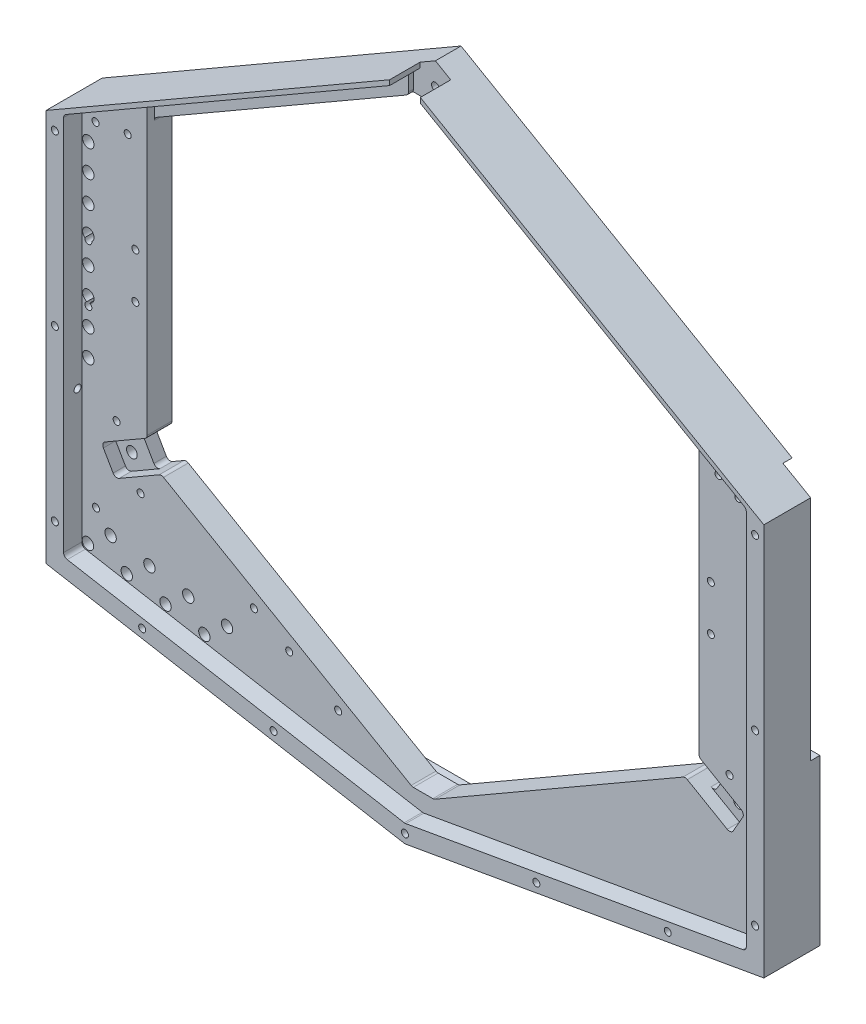
from build123d import *

# Parameters (mm, degrees)
OUTLINE_DEPTH                           = 12.8
INSIDE_CUTOUT_DEPTH                     = 4.14
CUT_FOR_SPRING_BASE_DEPTH               = 114.47095047549391
J_FLEX_MOUNTING_POINT_DEPTH             = 5.85
SPRING_BASE_MOUNTING_CUT_DEPTH          = 3
CENTRAL_COPPER_FLEX_CUTOUT_DEPTH        = 6.95
M2_TAP_DRILL_FOR_BACKPLATE_D            = 1.6
M2_TAP_DRILL_FOR_BACKPLATE_DEPTH        = 3.5
M2_TAP_DRILL_FOR_BACKPLATE_TIP          = 0.48068849522204826
OUTER_COPPER_FLEX_CUTOUTS_DEPTH         = 3
F_2_CLEARANCE_HOLES_FOR_FLEX_FEET_D     = 2.4384
CHANNELS_FOR_OUTER_FLEX_DEPTH           = 2.81
SKETCH17_R                              = 0.7999999999999954
OPTIONAL_ALIGNMENT_PINS_DEPTH           = 3
SMA_LINES_REACH                         = 115.471
SKETCH19_R                              = 1.2999999999999945
SKETCH19_R_2                            = 1.2999999999999956
SKETCH19_R_3                            = 1.2999999999999936
SKETCH19_R_4                            = 1.300000000000009
SKETCH19_R_5                            = 1.2999999999999803
SMA_CUTAWAY_DEPTH                       = 2.11
FILLET4_R                               = 3
M2X0_4_TAPPED_FOR_SMAS_D                = 1.6
M2X0_4_TAPPED_FOR_SMAS_DEPTH            = 5
M2X0_4_TAPPED_FOR_SMAS_TIP              = 0.48068849522204826
SLIGHT_RELIEF_UNDER_ARRAY_DEPTH         = 1.66
M2X0_4_TAPPED_FOR_RADIATION_COVER_D     = 1.6
M2X0_4_TAPPED_FOR_RADIATION_COVER_DEPTH = 5
M2X0_4_TAPPED_FOR_RADIATION_COVER_TIP   = 0.48068849522204826
M2X0_4_TAP_FOR_PCB_MOUNTS_D             = 1.6
M2X0_4_TAP_FOR_PCB_MOUNTS_DEPTH         = 4.7
M2X0_4_TAP_FOR_PCB_MOUNTS_TIP           = 0.48068849522204826
TAP_DRILL_FOR_M3X0_5_TAP1_D             = 2.5
TAP_DRILL_FOR_M3X0_5_TAP1_DEPTH         = 6
TAP_DRILL_FOR_M3X0_5_TAP1_TIP           = 0.7510757737844503
CUT_EXTRUDE1_DEPTH                      = 30
M2X0_4_TAP_FOR_THERMOMETER_D            = 1.6
M2X0_4_TAP_FOR_THERMOMETER_DEPTH        = 5
M2X0_4_TAP_FOR_THERMOMETER_TIP          = 0.48068849522204826
FILLET1_R                               = 1
FILLET5_R                               = 1
FILLET6_R                               = 3
TAP_DRILL_FOR_2_56_TAP2_D               = 1.778


with BuildPart() as part:
    # Sketch2 → Outline (new body)
    with BuildSketch(Plane.XY):
        Polygon((-81.94000000000018, 26.61740330842736), (-5.69e-15, 73.92548436582511), (81.93999999999981, 26.617403308426777), (81.93999999999981, -62.99628283492352), (-2.3854e-13, -77.44451563417489), (-81.94000000000018, -62.99628283492292), align=None)
    extrude(amount=-OUTLINE_DEPTH)

    # Sketch3 → Inside Cutout (cut)
    with BuildSketch(Plane.XY):
        Polygon((-77.94000000000018, 27.772103846806722), (-4.5471e-13, 72.77078382744601), (77.93999999999984, 27.77210384680643), (77.93999999999983, -59.63988431021399), (-2.2204e-13, -73.38280918663152), (-77.94000000000018, -59.63988431021344), align=None)
    extrude(amount=-INSIDE_CUTOUT_DEPTH, mode=Mode.SUBTRACT)

    # Sketch5 → Cut for Spring Base (cut, through all)
    with BuildSketch(Plane(origin=(0, 0, -12.8), x_dir=(-1, 0, 0), z_dir=(0, 0, -1))):
        Polygon((9.54e-15, -70.89415224396323), (-63.000000000000306, -34.52108528501766), (-63.000000000000306, 31.778914714982335), (-4.999999999999997, 65.26523032798063), (-5, 69.88403248149764), (4.5471e-13, 72.77078382744601), (5.000000000000001, 69.88403248149814), (5.000000000000001, 65.26523032798113), (62.999999999999694, 31.778914714983017), (62.999999999999694, -34.52108528501698), align=None)
    extrude(amount=-CUT_FOR_SPRING_BASE_DEPTH, mode=Mode.SUBTRACT)

    # Sketch7 → J Flex Mounting Point (add)
    with BuildSketch(Plane(origin=(0, 0, -12.8), x_dir=(-1, 0, 0), z_dir=(0, 0, -1))):
        Polygon((-4.999999999999885, 69.88403248149771), (4.545e-13, 72.77078382744601), (5.000000000000114, 69.88403248149808), (5.000000000000114, 60.77078382744578), (-4.999999999999885, 60.77078382744578), align=None)
    extrude(amount=-J_FLEX_MOUNTING_POINT_DEPTH)

    # Sketch6 → Spring Base Mounting Cut (cut)
    with BuildSketch(Plane(origin=(0, 0, -12.8), x_dir=(-1, 0, 0), z_dir=(0, 0, -1))):
        Polygon((-67.5000000000003, 33.79964065714584), (-67.5000000000003, -37.6965117655606), (-10.000000000001764, -70.89415224396323), (9.54e-15, -70.89415224396323), (9.999999999999995, -70.89415224396323), (67.4999999999997, -37.69651176555993), (67.4999999999997, 33.79964065714669), (6.94e-15, 72.77078382744575), align=None)
    extrude(amount=-SPRING_BASE_MOUNTING_CUT_DEPTH, mode=Mode.SUBTRACT)

    # Sketch9 → Central Copper Flex cutout (cut)
    with BuildSketch(Plane.XY):
        Polygon((3.4999999999995532, 71.90475842366207), (3.4999999999995532, 70.75005788528236), (-4.5471e-13, 72.77078382744601), (-3.5000000000004468, 70.75005788528233), (-3.5000000000004468, 71.90475842366156), (-9.54e-15, 73.92548436582551), align=None)
    extrude(amount=-CENTRAL_COPPER_FLEX_CUTOUT_DEPTH, mode=Mode.SUBTRACT)

    # M2 Tap Drill for Backplate
    with Locations(Plane(origin=(0, 0, -9.799999999999999), x_dir=(-1, 0, 0), z_dir=(0, 0, -1))):
        with Locations((-65, 24.304214177), (-41.13620668, 46.134032481), (-19.485571585, 58.634032481), (19.485571585, 58.634032481), (41.13620668, 46.134032481), (65, 24.324214177), (65, 1.824214177), (65, -20.675785823), (52.009618943, -43.175785823), (32.95706006, -54.175785823), (15.636551984, -64.175785823), (-15.636551984, -64.175785823), (-32.95706006, -54.175785823), (-52.009618943, -43.175785823), (-65, -20.695785823), (-65, 1.804214177)):
            Hole(M2_TAP_DRILL_FOR_BACKPLATE_D / 2, depth=M2_TAP_DRILL_FOR_BACKPLATE_DEPTH)
            with Locations((0, 0, -(M2_TAP_DRILL_FOR_BACKPLATE_DEPTH + M2_TAP_DRILL_FOR_BACKPLATE_TIP / 2))):  # 118° drill point
                Cone(0, M2_TAP_DRILL_FOR_BACKPLATE_D / 2, M2_TAP_DRILL_FOR_BACKPLATE_TIP, mode=Mode.SUBTRACT)

    # Sketch12 → Outer Copper Flex cutouts (cut)
    with BuildSketch(Plane(origin=(0, 0, -12.8), x_dir=(-1, 0, 0), z_dir=(0, 0, -1))):
        Polygon((63.999999999999694, -39.71723770772362), (67.4999999999997, -37.69651176555993), (67.4999999999997, -33.655059881232546), (74.44615242270633, -37.66542285231435), (70.94615242270635, -43.72760067880543), align=None)
        Polygon((-67.5000000000003, -33.65505988123323), (-67.5000000000003, -37.6965117655606), (-64.0000000000003, -39.717237707724294), (-70.94615242270693, -43.72760067880614), (-74.44615242270693, -37.66542285231507), align=None)
    extrude(amount=-OUTER_COPPER_FLEX_CUTOUTS_DEPTH, mode=Mode.SUBTRACT)

    # #2 Clearance Holes for Flex Feet (through all)
    with Locations(Plane(origin=(0, 0, -9.799999999999999), x_dir=(-1, 0, 0), z_dir=(0, 0, -1))):
        with Locations((69.303682938, -38.129015634), (-69.308013065, -38.131515634)):
            Hole(F_2_CLEARANCE_HOLES_FOR_FLEX_FEET_D / 2)

    # Sketch15 → Channels for Outer Flex (cut)
    with BuildSketch(Plane.XY.offset(-4.14)):
        Polygon((-62.999999999999694, -30.794540870306964), (-73.50175914920308, -36.85773434206413), (-70.27447701773319, -42.44755096412918), (-59.77271786852982, -36.38435749237198), (-62.999999999999694, -34.52108528501698), align=None)
        Polygon((63.000000000000306, -34.52108528501766), (63.000000000000306, -30.857546254101788), (73.47880714475102, -36.9074883799115), (70.30608927622175, -42.4027969262845), (59.82728213147089, -36.35285480047483), align=None)
    extrude(amount=-CHANNELS_FOR_OUTER_FLEX_DEPTH, mode=Mode.SUBTRACT)

    # Sketch17 → Optional Alignment Pins (cut)
    with BuildSketch(Plane(origin=(0, 0, -9.799999999999999), x_dir=(-1, 0, 0), z_dir=(0, 0, -1))):
        with Locations((-65.00000000000033, -9.44578582339588)):
            Circle(SKETCH17_R)
        with Locations((64.99999999999972, -9.425785823396222)):
            Circle(SKETCH17_R)
    extrude(amount=-OPTIONAL_ALIGNMENT_PINS_DEPTH, mode=Mode.SUBTRACT)

    # Sketch19 → SMA_Lines (cut, up to next)
    with BuildSketch(Plane(origin=(0, 0, -12.8), x_dir=(-1, 0, 0), z_dir=(0, 0, -1)), mode=Mode.PRIVATE) as sma_lines_sk1:
        with Locations((76.44000000000017, 21.11740330842736)):
            Circle(SKETCH19_R)
    sma_lines_tool1 = extrude(sma_lines_sk1.sketch, amount=-SMA_LINES_REACH, mode=Mode.PRIVATE) & part.part
    # Sketch19 → SMA_Lines (cut, up to next)
    with BuildSketch(Plane(origin=(0, 0, -12.8), x_dir=(-1, 0, 0), z_dir=(0, 0, -1)), mode=Mode.PRIVATE) as sma_lines_sk2:
        with Locations((-76.43999999999981, 22.617403308426777)):
            Circle(SKETCH19_R)
    sma_lines_tool2 = extrude(sma_lines_sk2.sketch, amount=-SMA_LINES_REACH, mode=Mode.PRIVATE) & part.part
    # Sketch19 → SMA_Lines (cut, up to next)
    with BuildSketch(Plane(origin=(0, 0, -12.8), x_dir=(-1, 0, 0), z_dir=(0, 0, -1)), mode=Mode.PRIVATE) as sma_lines_sk3:
        with Locations((-76.4399999999995, 16.517403308426776)):
            Circle(SKETCH19_R_2)
    sma_lines_tool3 = extrude(sma_lines_sk3.sketch, amount=-SMA_LINES_REACH, mode=Mode.PRIVATE) & part.part
    # Sketch19 → SMA_Lines (cut, up to next)
    with BuildSketch(Plane(origin=(0, 0, -12.8), x_dir=(-1, 0, 0), z_dir=(0, 0, -1)), mode=Mode.PRIVATE) as sma_lines_sk4:
        with Locations((-76.43999999999916, 10.41740330842678)):
            Circle(SKETCH19_R)
    sma_lines_tool4 = extrude(sma_lines_sk4.sketch, amount=-SMA_LINES_REACH, mode=Mode.PRIVATE) & part.part
    # Sketch19 → SMA_Lines (cut, up to next)
    with BuildSketch(Plane(origin=(0, 0, -12.8), x_dir=(-1, 0, 0), z_dir=(0, 0, -1)), mode=Mode.PRIVATE) as sma_lines_sk5:
        with Locations((-76.43999999999885, 4.3174033084267815)):
            Circle(SKETCH19_R)
    sma_lines_tool5 = extrude(sma_lines_sk5.sketch, amount=-SMA_LINES_REACH, mode=Mode.PRIVATE) & part.part
    # Sketch19 → SMA_Lines (cut, up to next)
    with BuildSketch(Plane(origin=(0, 0, -12.8), x_dir=(-1, 0, 0), z_dir=(0, 0, -1)), mode=Mode.PRIVATE) as sma_lines_sk6:
        with Locations((-76.43999999999852, -1.7825966915732196)):
            Circle(SKETCH19_R)
    sma_lines_tool6 = extrude(sma_lines_sk6.sketch, amount=-SMA_LINES_REACH, mode=Mode.PRIVATE) & part.part
    # Sketch19 → SMA_Lines (cut, up to next)
    with BuildSketch(Plane(origin=(0, 0, -12.8), x_dir=(-1, 0, 0), z_dir=(0, 0, -1)), mode=Mode.PRIVATE) as sma_lines_sk7:
        with Locations((-76.4399999999982, -7.882596691573221)):
            Circle(SKETCH19_R)
    sma_lines_tool7 = extrude(sma_lines_sk7.sketch, amount=-SMA_LINES_REACH, mode=Mode.PRIVATE) & part.part
    # Sketch19 → SMA_Lines (cut, up to next)
    with BuildSketch(Plane(origin=(0, 0, -12.8), x_dir=(-1, 0, 0), z_dir=(0, 0, -1)), mode=Mode.PRIVATE) as sma_lines_sk8:
        with Locations((-76.43999999999787, -13.982596691573216)):
            Circle(SKETCH19_R)
    sma_lines_tool8 = extrude(sma_lines_sk8.sketch, amount=-SMA_LINES_REACH, mode=Mode.PRIVATE) & part.part
    # Sketch19 → SMA_Lines (cut, up to next)
    with BuildSketch(Plane(origin=(0, 0, -12.8), x_dir=(-1, 0, 0), z_dir=(0, 0, -1)), mode=Mode.PRIVATE) as sma_lines_sk9:
        with Locations((-76.43999999999755, -20.082596691573215)):
            Circle(SKETCH19_R)
    sma_lines_tool9 = extrude(sma_lines_sk9.sketch, amount=-SMA_LINES_REACH, mode=Mode.PRIVATE) & part.part
    # Sketch19 → SMA_Lines (cut, up to next)
    with BuildSketch(Plane(origin=(0, 0, -12.8), x_dir=(-1, 0, 0), z_dir=(0, 0, -1)), mode=Mode.PRIVATE) as sma_lines_sk10:
        with Locations((76.44000000000041, 15.01740330842736)):
            Circle(SKETCH19_R)
    sma_lines_tool10 = extrude(sma_lines_sk10.sketch, amount=-SMA_LINES_REACH, mode=Mode.PRIVATE) & part.part
    # Sketch19 → SMA_Lines (cut, up to next)
    with BuildSketch(Plane(origin=(0, 0, -12.8), x_dir=(-1, 0, 0), z_dir=(0, 0, -1)), mode=Mode.PRIVATE) as sma_lines_sk11:
        with Locations((76.44000000000065, 8.91740330842736)):
            Circle(SKETCH19_R)
    sma_lines_tool11 = extrude(sma_lines_sk11.sketch, amount=-SMA_LINES_REACH, mode=Mode.PRIVATE) & part.part
    # Sketch19 → SMA_Lines (cut, up to next)
    with BuildSketch(Plane(origin=(0, 0, -12.8), x_dir=(-1, 0, 0), z_dir=(0, 0, -1)), mode=Mode.PRIVATE) as sma_lines_sk12:
        with Locations((76.44000000000088, 2.8174033084273633)):
            Circle(SKETCH19_R)
    sma_lines_tool12 = extrude(sma_lines_sk12.sketch, amount=-SMA_LINES_REACH, mode=Mode.PRIVATE) & part.part
    # Sketch19 → SMA_Lines (cut, up to next)
    with BuildSketch(Plane(origin=(0, 0, -12.8), x_dir=(-1, 0, 0), z_dir=(0, 0, -1)), mode=Mode.PRIVATE) as sma_lines_sk13:
        with Locations((76.44000000000112, -3.282596691572638)):
            Circle(SKETCH19_R)
    sma_lines_tool13 = extrude(sma_lines_sk13.sketch, amount=-SMA_LINES_REACH, mode=Mode.PRIVATE) & part.part
    # Sketch19 → SMA_Lines (cut, up to next)
    with BuildSketch(Plane(origin=(0, 0, -12.8), x_dir=(-1, 0, 0), z_dir=(0, 0, -1)), mode=Mode.PRIVATE) as sma_lines_sk14:
        with Locations((76.44000000000135, -9.382596691572639)):
            Circle(SKETCH19_R)
    sma_lines_tool14 = extrude(sma_lines_sk14.sketch, amount=-SMA_LINES_REACH, mode=Mode.PRIVATE) & part.part
    # Sketch19 → SMA_Lines (cut, up to next)
    with BuildSketch(Plane(origin=(0, 0, -12.8), x_dir=(-1, 0, 0), z_dir=(0, 0, -1)), mode=Mode.PRIVATE) as sma_lines_sk15:
        with Locations((76.44000000000159, -15.482596691572633)):
            Circle(SKETCH19_R)
    sma_lines_tool15 = extrude(sma_lines_sk15.sketch, amount=-SMA_LINES_REACH, mode=Mode.PRIVATE) & part.part
    # Sketch19 → SMA_Lines (cut, up to next)
    with BuildSketch(Plane(origin=(0, 0, -12.8), x_dir=(-1, 0, 0), z_dir=(0, 0, -1)), mode=Mode.PRIVATE) as sma_lines_sk16:
        with Locations((76.44000000000183, -21.582596691572636)):
            Circle(SKETCH19_R)
    sma_lines_tool16 = extrude(sma_lines_sk16.sketch, amount=-SMA_LINES_REACH, mode=Mode.PRIVATE) & part.part
    # Sketch19 → SMA_Lines (cut, up to next)
    with BuildSketch(Plane(origin=(0, 0, -12.8), x_dir=(-1, 0, 0), z_dir=(0, 0, -1)), mode=Mode.PRIVATE) as sma_lines_sk17:
        with Locations((49.940000000000175, -63.053899852222344)):
            Circle(SKETCH19_R_3)
    sma_lines_tool17 = extrude(sma_lines_sk17.sketch, amount=-SMA_LINES_REACH, mode=Mode.PRIVATE) & part.part
    # Sketch19 → SMA_Lines (cut, up to next)
    with BuildSketch(Plane(origin=(0, 0, -12.8), x_dir=(-1, 0, 0), z_dir=(0, 0, -1)), mode=Mode.PRIVATE) as sma_lines_sk18:
        with Locations((44.76298760688293, -58.8896137571623)):
            Circle(SKETCH19_R_3)
    sma_lines_tool18 = extrude(sma_lines_sk18.sketch, amount=-SMA_LINES_REACH, mode=Mode.PRIVATE) & part.part
    # Sketch19 → SMA_Lines (cut, up to next)
    with BuildSketch(Plane(origin=(0, 0, -12.8), x_dir=(-1, 0, 0), z_dir=(0, 0, -1)), mode=Mode.PRIVATE) as sma_lines_sk19:
        with Locations((53.626257383992794, -57.32678015815989)):
            Circle(SKETCH19_R_3)
    sma_lines_tool19 = extrude(sma_lines_sk19.sketch, amount=-SMA_LINES_REACH, mode=Mode.PRIVATE) & part.part
    # Sketch19 → SMA_Lines (cut, up to next)
    with BuildSketch(Plane(origin=(0, 0, -12.8), x_dir=(-1, 0, 0), z_dir=(0, 0, -1)), mode=Mode.PRIVATE) as sma_lines_sk20:
        with Locations((58.80326977711004, -61.491066253219934)):
            Circle(SKETCH19_R_3)
    sma_lines_tool20 = extrude(sma_lines_sk20.sketch, amount=-SMA_LINES_REACH, mode=Mode.PRIVATE) & part.part
    # Sketch19 → SMA_Lines (cut, up to next)
    with BuildSketch(Plane(origin=(0, 0, -12.8), x_dir=(-1, 0, 0), z_dir=(0, 0, -1)), mode=Mode.PRIVATE) as sma_lines_sk21:
        with Locations((62.489527161102664, -55.76394655915748)):
            Circle(SKETCH19_R_4)
    sma_lines_tool21 = extrude(sma_lines_sk21.sketch, amount=-SMA_LINES_REACH, mode=Mode.PRIVATE) & part.part
    # Sketch19 → SMA_Lines (cut, up to next)
    with BuildSketch(Plane(origin=(0, 0, -12.8), x_dir=(-1, 0, 0), z_dir=(0, 0, -1)), mode=Mode.PRIVATE) as sma_lines_sk22:
        with Locations((67.66653955421991, -59.928232654217524)):
            Circle(SKETCH19_R_5)
    sma_lines_tool22 = extrude(sma_lines_sk22.sketch, amount=-SMA_LINES_REACH, mode=Mode.PRIVATE) & part.part
    # Sketch19 → SMA_Lines (cut, up to next)
    with BuildSketch(Plane(origin=(0, 0, -12.8), x_dir=(-1, 0, 0), z_dir=(0, 0, -1)), mode=Mode.PRIVATE) as sma_lines_sk23:
        with Locations((71.35279693821253, -54.20111296015507)):
            Circle(SKETCH19_R_3)
    sma_lines_tool23 = extrude(sma_lines_sk23.sketch, amount=-SMA_LINES_REACH, mode=Mode.PRIVATE) & part.part
    # Sketch19 → SMA_Lines (cut, up to next)
    with BuildSketch(Plane(origin=(0, 0, -12.8), x_dir=(-1, 0, 0), z_dir=(0, 0, -1)), mode=Mode.PRIVATE) as sma_lines_sk24:
        with Locations((76.52980933132977, -58.365399055215114)):
            Circle(SKETCH19_R_3)
    sma_lines_tool24 = extrude(sma_lines_sk24.sketch, amount=-SMA_LINES_REACH, mode=Mode.PRIVATE) & part.part
    add(sma_lines_tool1.solids().sort_by_distance((-76.44, 21.117403, -12.8))[0], mode=Mode.SUBTRACT)
    add(sma_lines_tool2.solids().sort_by_distance((76.44, 22.617403, -12.8))[0], mode=Mode.SUBTRACT)
    add(sma_lines_tool3.solids().sort_by_distance((76.44, 16.517403, -12.8))[0], mode=Mode.SUBTRACT)
    add(sma_lines_tool4.solids().sort_by_distance((76.44, 10.417403, -12.8))[0], mode=Mode.SUBTRACT)
    add(sma_lines_tool5.solids().sort_by_distance((76.44, 4.317403, -12.8))[0], mode=Mode.SUBTRACT)
    add(sma_lines_tool6.solids().sort_by_distance((76.44, -1.782597, -12.8))[0], mode=Mode.SUBTRACT)
    add(sma_lines_tool7.solids().sort_by_distance((76.44, -7.882597, -12.8))[0], mode=Mode.SUBTRACT)
    add(sma_lines_tool8.solids().sort_by_distance((76.44, -13.982597, -12.8))[0], mode=Mode.SUBTRACT)
    add(sma_lines_tool9.solids().sort_by_distance((76.44, -20.082597, -12.8))[0], mode=Mode.SUBTRACT)
    add(sma_lines_tool10.solids().sort_by_distance((-76.44, 15.017403, -12.8))[0], mode=Mode.SUBTRACT)
    add(sma_lines_tool11.solids().sort_by_distance((-76.44, 8.917403, -12.8))[0], mode=Mode.SUBTRACT)
    add(sma_lines_tool12.solids().sort_by_distance((-76.44, 2.817403, -12.8))[0], mode=Mode.SUBTRACT)
    add(sma_lines_tool13.solids().sort_by_distance((-76.44, -3.282597, -12.8))[0], mode=Mode.SUBTRACT)
    add(sma_lines_tool14.solids().sort_by_distance((-76.44, -9.382597, -12.8))[0], mode=Mode.SUBTRACT)
    add(sma_lines_tool15.solids().sort_by_distance((-76.44, -15.482597, -12.8))[0], mode=Mode.SUBTRACT)
    add(sma_lines_tool16.solids().sort_by_distance((-76.44, -21.582597, -12.8))[0], mode=Mode.SUBTRACT)
    add(sma_lines_tool17.solids().sort_by_distance((-49.94, -63.0539, -12.8))[0], mode=Mode.SUBTRACT)
    add(sma_lines_tool18.solids().sort_by_distance((-44.762988, -58.889614, -12.8))[0], mode=Mode.SUBTRACT)
    add(sma_lines_tool19.solids().sort_by_distance((-53.626257, -57.32678, -12.8))[0], mode=Mode.SUBTRACT)
    add(sma_lines_tool20.solids().sort_by_distance((-58.80327, -61.491066, -12.8))[0], mode=Mode.SUBTRACT)
    add(sma_lines_tool21.solids().sort_by_distance((-62.489527, -55.763947, -12.8))[0], mode=Mode.SUBTRACT)
    add(sma_lines_tool22.solids().sort_by_distance((-67.66654, -59.928233, -12.8))[0], mode=Mode.SUBTRACT)
    add(sma_lines_tool23.solids().sort_by_distance((-71.352797, -54.201113, -12.8))[0], mode=Mode.SUBTRACT)
    add(sma_lines_tool24.solids().sort_by_distance((-76.529809, -58.365399, -12.8))[0], mode=Mode.SUBTRACT)

    # Sketch20 → SMA Cutaway (cut)
    with BuildSketch(Plane(origin=(0, 0, -12.8), x_dir=(-1, 0, 0), z_dir=(0, 0, -1))):
        Polygon((67.4999999999997, 23.84466519800491), (73.08124278936407, 29.425907987369293), (81.94000000000017, 20.567150776733197), (81.94000000000018, -62.99628283492253), (42.44000000000018, -69.96119857290746), (42.44000000000018, -58.914909511451675), (37.67686027918577, -58.914909511451675), (37.67686027918577, -54.914909511451675), (42.4400000000002, -52.16490951145166), (63.999999999999694, -39.71723770772362), (67.4999999999997, -33.655059881232546), align=None)
        Polygon((-75.60958527266814, 30.27226995533369), (-67.5000000000003, 22.162684682665844), (-67.5000000000003, -25.38259669157322), (-81.93999999999981, -25.382596691573223), (-81.93999999999981, 26.61740330842717), align=None)
    extrude(amount=-SMA_CUTAWAY_DEPTH, mode=Mode.SUBTRACT)

    # Fillet4
    fillet4_edges = [part.edges().sort_by_distance(p)[0] for p in [
        (-37.67686027918577, -58.914909511451675, -11.745000000000001),
        (-73.08124278936407, 29.425907987369293, -11.745000000000001),
    ]]
    fillet(fillet4_edges, radius=FILLET4_R)

    # M2x0.4 Tapped for SMAs
    with Locations(Plane(origin=(0, 0, -10.689999999999998), x_dir=(-1, 0, 0), z_dir=(0, 0, -1))):
        with Locations((73.895, 23.662403308), (78.985, 18.572403308), (-78.985, 25.162403308), (-73.895, 20.072403308), (-78.985, 19.062403308), (-73.895, 13.972403308), (-78.985, 12.962403308), (-73.895, 7.872403308), (-78.985, 6.862403308), (-73.895, 1.772403308), (-78.985, 0.762403308), (-73.895, -4.327596692), (-78.985, -5.337596692), (-73.895, -10.427596692), (-78.985, -11.437596692), (-73.895, -16.527596692), (-78.985, -17.537596692), (-73.895, -22.627596692), (73.895, 17.562403308), (78.985, 12.472403308), (73.895, 11.462403308), (78.985, 6.372403308), (73.895, 5.362403308), (78.985, 0.272403308), (73.895, -0.737596692), (78.985, -5.827596692), (73.895, -6.837596692), (78.985, -11.927596692), (73.895, -12.937596692), (78.985, -18.027596692), (73.895, -19.037596692), (78.985, -24.127596692), (49.315, -59.508899852), (50.565, -66.598899852), (58.178269777, -57.946066253), (59.428269777, -65.036066253), (67.041539554, -56.383232654), (68.291539554, -63.473232654), (75.904809331, -54.820399055), (77.154809331, -61.910399055), (45.387987607, -62.434613757), (44.137987607, -55.344613757), (54.251257384, -60.871780158), (53.001257384, -53.781780158), (63.114527161, -59.308946559), (61.864527161, -52.218946559), (71.977796938, -57.74611296), (70.727796938, -50.65611296)):
            Hole(M2X0_4_TAPPED_FOR_SMAS_D / 2, depth=M2X0_4_TAPPED_FOR_SMAS_DEPTH)
            with Locations((0, 0, -(M2X0_4_TAPPED_FOR_SMAS_DEPTH + M2X0_4_TAPPED_FOR_SMAS_TIP / 2))):  # 118° drill point
                Cone(0, M2X0_4_TAPPED_FOR_SMAS_D / 2, M2X0_4_TAPPED_FOR_SMAS_TIP, mode=Mode.SUBTRACT)

    # Sketch23 → Slight Relief Under Array (cut)
    with BuildSketch(Plane.XY.offset(-4.14)):
        Polygon((-62.999999999999694, 31.778914714983017), (-62.999999999999694, 36.39771686850003), (-5.000000000000001, 69.88403248149814), (-5.000000000000001, 65.26523032798113), align=None)
        Polygon((4.999999999999999, 65.26523032798063), (4.999999999999999, 69.88403248149764), (63.000000000000306, 36.397716868499174), (63.000000000000306, 31.778914714982335), align=None)
    extrude(amount=-SLIGHT_RELIEF_UNDER_ARRAY_DEPTH, mode=Mode.SUBTRACT)

    # M2x0.4 Tapped for Radiation Cover
    with Locations(Plane.XY):
        with Locations((-79.94, 23.617403308), (-79.94, -53.63988431), (-30, -70.123852989), (30, -70.123852989), (79.94, -53.63988431), (79.94, 23.617403308), (-79.94, -15.011240501), (0, -75.41366241), (79.94, -15.011240501), (-60, -64.834043568), (60, -64.834043568)):
            Hole(M2X0_4_TAPPED_FOR_RADIATION_COVER_D / 2, depth=M2X0_4_TAPPED_FOR_RADIATION_COVER_DEPTH)
            with Locations((0, 0, -(M2X0_4_TAPPED_FOR_RADIATION_COVER_DEPTH + M2X0_4_TAPPED_FOR_RADIATION_COVER_TIP / 2))):  # 118° drill point
                Cone(0, M2X0_4_TAPPED_FOR_RADIATION_COVER_D / 2, M2X0_4_TAPPED_FOR_RADIATION_COVER_TIP, mode=Mode.SUBTRACT)

    # M2x0.4 Tap for PCB Mounts
    with Locations(Plane.XY.offset(-4.14)):
        with Locations((76.44, 12.367403308), (74.69, -12.632596692), (-76.44, 14.617403308), (-76.44, -11.382596692), (-74.69, -50.382596692), (-19.3942, -62.851596692), (-76.44, 1.617403308), (-67.45, 27.111803308), (-65.6984, 5.145603308), (-65.6984, -5.187396692), (-69.9656, -30.882596692), (-64.5046, -42.434796692), (-38.622, -52.234396692), (-30.5702, -56.755596692), (71.966178048, 24.850096108), (74.69, -0.132596692), (69.97, -30.882596692), (67.45, 27.111803308), (65.7, 5.145603308), (65.7, -5.187396692), (-74.788247876, 25.83669509)):
            Hole(M2X0_4_TAP_FOR_PCB_MOUNTS_D / 2, depth=M2X0_4_TAP_FOR_PCB_MOUNTS_DEPTH)
            with Locations((0, 0, -(M2X0_4_TAP_FOR_PCB_MOUNTS_DEPTH + M2X0_4_TAP_FOR_PCB_MOUNTS_TIP / 2))):  # 118° drill point
                Cone(0, M2X0_4_TAP_FOR_PCB_MOUNTS_D / 2, M2X0_4_TAP_FOR_PCB_MOUNTS_TIP, mode=Mode.SUBTRACT)

    # Tap Drill for M3x0.5 Tap1
    with Locations(Plane(origin=(0, 0, -12.8), x_dir=(-1, 0, 0), z_dir=(0, 0, -1))):
        with Locations((-69.353829072, 29.770783827), (69.353829072, 29.770783827), (40, -61.444515634), (-40, -61.444515634)):
            Hole(TAP_DRILL_FOR_M3X0_5_TAP1_D / 2, depth=TAP_DRILL_FOR_M3X0_5_TAP1_DEPTH)
            with Locations((0, 0, -(TAP_DRILL_FOR_M3X0_5_TAP1_DEPTH + TAP_DRILL_FOR_M3X0_5_TAP1_TIP / 2))):  # 118° drill point
                Cone(0, TAP_DRILL_FOR_M3X0_5_TAP1_D / 2, TAP_DRILL_FOR_M3X0_5_TAP1_TIP, mode=Mode.SUBTRACT)

    # Sketch33 → Cut-Extrude1 (cut)
    with BuildSketch(Plane.XY.offset(-6.949999999999999)):
        Polygon((-67.0065686208198, -33.107734342064134), (-63.7792864893499, -38.69755096412917), (-58.58313406664326, -35.697550964129164), (-61.81041619811316, -30.107734342064127), align=None)
        Polygon((66.98361661636788, -33.15748837991099), (63.810898747839296, -38.65279692628415), (58.61474632513267, -35.65279692628415), (61.787464193661265, -30.157488379910987), align=None)
        Polygon((-6.490381056767053, 64.40475842366156), (-6.490381056767053, 58.404758423661555), (6.49038105676619, 58.404758423661555), (6.490381056766191, 64.40475842366156), (4.999999999999997, 65.26523032798063), (-5.000000000000001, 65.26523032798113), align=None)
    extrude(amount=-CUT_EXTRUDE1_DEPTH, mode=Mode.SUBTRACT)

    # M2x0.4 Tap for Thermometer
    with Locations(Plane.ZY.offset(81.94000000000018)):
        with Locations((-3.19, -27.996282835)):
            Hole(M2X0_4_TAP_FOR_THERMOMETER_D / 2, depth=M2X0_4_TAP_FOR_THERMOMETER_DEPTH)
            with Locations((0, 0, -(M2X0_4_TAP_FOR_THERMOMETER_DEPTH + M2X0_4_TAP_FOR_THERMOMETER_TIP / 2))):  # 118° drill point
                Cone(0, M2X0_4_TAP_FOR_THERMOMETER_D / 2, M2X0_4_TAP_FOR_THERMOMETER_TIP, mode=Mode.SUBTRACT)

    # Fillet1
    fillet1_edges = [part.edges().sort_by_distance(p)[0] for p in [
        (-5.000000000000001, 65.26523032798113, -6.375),
        (-5.000000000000001, 69.88403248149814, -6.375),
        (5, 69.88403248149764, -6.375),
        (4.999999999999997, 65.26523032798063, -6.375),
        (-62.999999999999694, 31.778914714983017, -7.800000000000001),
        (63.000000000000306, 31.778914714982335, -7.800000000000001),
        (-62.999999999999694, 36.39771686850003, -4.97),
        (63.000000000000306, 36.397716868499174, -4.97),
        (-67.0065686208198, -33.107734342064134, -8.375),
        (-63.7792864893499, -38.69755096412917, -8.375),
        (67.5000000000003, 33.79964065714584, -11.3),
        (-6.94e-15, 72.77078382744575, -11.3),
        (63.810898747839296, -38.65279692628415, -8.375),
        (66.98361661636788, -33.15748837991099, -8.375),
        (-67.4999999999997, 33.79964065714669, -11.3),
        (-9.999999999999995, -70.89415224396323, -11.3),
        (10.000000000001764, -70.89415224396323, -11.3),
        (-77.94000000000018, -59.63988431021344, -2.07),
        (-77.94000000000018, 27.772103846806722, -2.07),
        (77.93999999999984, 27.77210384680643, -2.07),
        (77.93999999999983, -59.63988431021399, -2.07),
        (-2.2204e-13, -73.38280918663152, -2.07),
        (-70.94615242270635, -43.72760067880543, -10.245000000000001),
        (-63.999999999999694, -39.71723770772362, -10.245000000000001),
        (-67.4999999999997, -33.655059881232546, -10.245000000000001),
        (-74.44615242270633, -37.66542285231435, -10.245000000000001),
        (74.44615242270693, -37.66542285231507, -11.3),
        (67.5000000000003, -33.65505988123323, -11.3),
        (64.0000000000003, -39.717237707724294, -11.3),
        (70.94615242270693, -43.72760067880614, -11.3),
        (-62.999999999999694, -30.79454087030695, -6.970000000000001),
        (-59.77271786852981, -36.38435749237199, -6.970000000000001),
        (-70.27447701773319, -42.44755096412918, -5.545),
        (-73.50175914920308, -36.85773434206413, -5.545),
        (59.82728213147098, -36.35285480047526, -6.970000000000001),
        (63.000000000000306, -30.85754625410234, -6.970000000000001),
        (73.47880714475102, -36.9074883799115, -5.545),
        (70.30608927622175, -42.4027969262845, -5.545),
    ]]
    fillet(fillet1_edges, radius=FILLET1_R)

    # Fillet2
    # the kernel refuses this chamfer: 5 mm, written as the material it adds along each edge
    with BuildSketch(Plane(origin=(-9.54e-15, -70.89415224396323, -9.8), x_dir=(0.8818947015264238, 0.47144642900293543, 0), z_dir=(0, 0, 1))) as fillet2_piece_1:
        with BuildLine():
            Line((3.0615900008546393, 3e-17), (-1.7006413873879895, 2.545810716615868))
            Line((-1.7006413873879895, 2.545810716615868), (-1.785564580868314, 2.4930087165675308))
            ThreePointArc((-1.785564580868314, 2.4930087165675308), (-0.8927822904341519, 1.246504358283763), (-0.08492319348032422, -0.05280200004833689))
            Line((-0.08492319348032422, -0.05280200004833689), (0.00326627667231724, -0.09994664294862994))
            ThreePointArc((0.00326627667231724, -0.09994664294862994), (1.5324281387634773, -0.04997332147432252), (3.0648562775269563, -0.09994664294862984))
            Line((3.0648562775269563, -0.09994664294862984), (3.0615900008546393, 3e-17))
        make_face()
    extrude(amount=5.66)

    # Fillet5
    fillet5_edges = [part.edges().sort_by_distance(p)[0] for p in [
        (-2.499999999999483, -69.45077657098946, -6.970000000000001),
        (2.500000000001778, -69.45077657098818, -6.970000000000001),
    ]]
    fillet(fillet5_edges, radius=FILLET5_R)

    # Fillet6
    fillet6_edges = [part.edges().sort_by_distance(p)[0] for p in [
        (-42.44000000000018, -58.914909511451675, -11.745000000000001),
    ]]
    fillet(fillet6_edges, radius=FILLET6_R)

    # Tap Drill for #2-56 Tap2 (through all)
    with Locations(Plane(origin=(0, 0, -9.799999999999999), x_dir=(-1, 0, 0), z_dir=(0, 0, -1))):
        with Locations((0, 68.8)):
            Hole(TAP_DRILL_FOR_2_56_TAP2_D / 2)


solid = part.part
